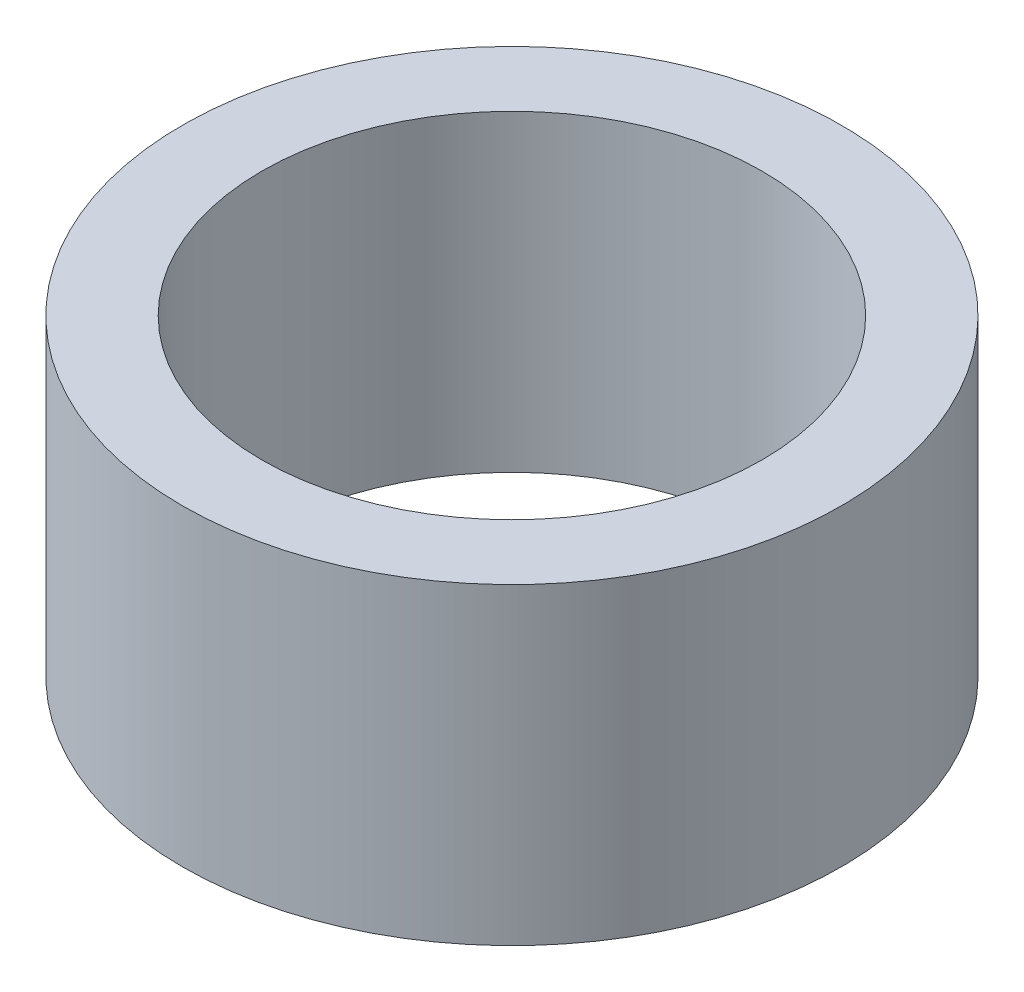
from build123d import *

# Parameters (mm, degrees)
SKETCH1_R           = 5.27
SKETCH1_R_2         = 4
BOSS_EXTRUDE1_DEPTH = 5


with BuildPart() as part:
    # Sketch1 → Boss-Extrude1 (new body)
    with BuildSketch(Plane(origin=(0, 0, 0), x_dir=(1, 0, 0), z_dir=(0, 1, 0))):
        Circle(SKETCH1_R)
        Circle(SKETCH1_R_2, mode=Mode.SUBTRACT)
    extrude(amount=BOSS_EXTRUDE1_DEPTH)


solid = part.part
